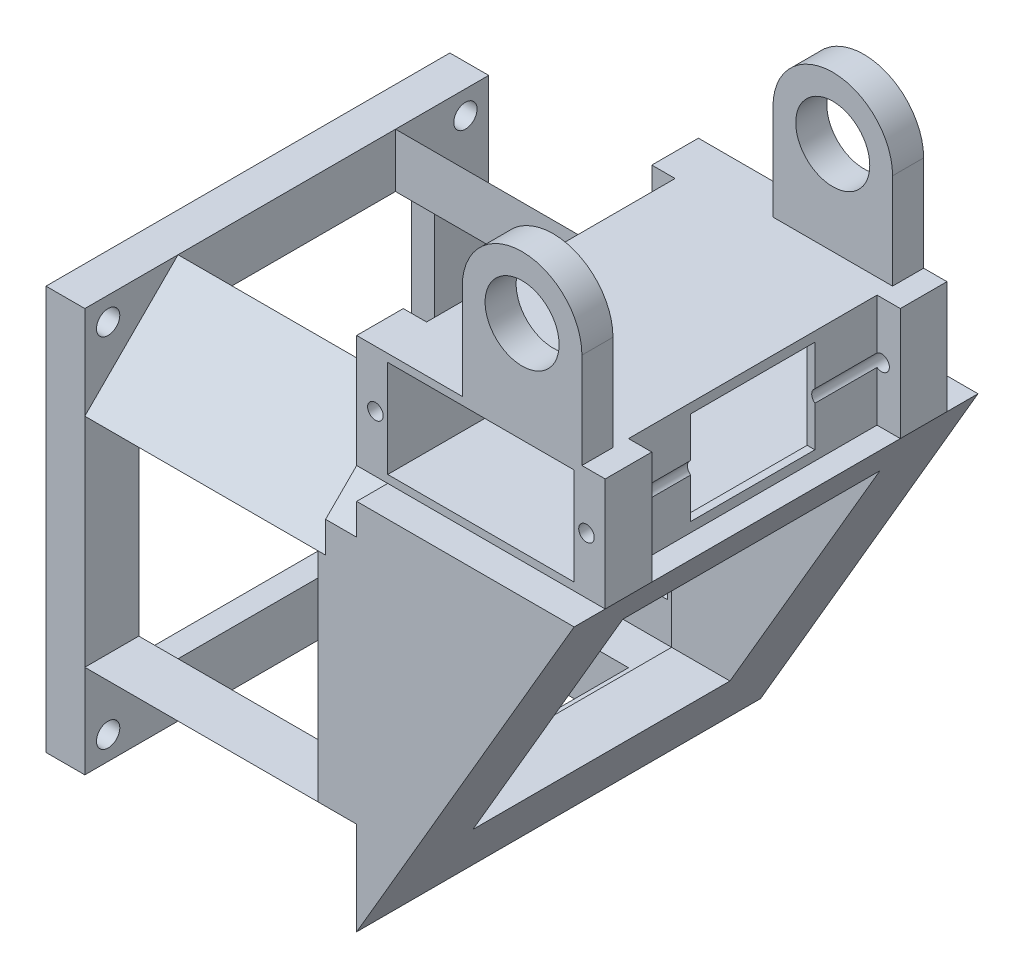
from build123d import *

# Parameters (mm, degrees)
SKETCH1_W            = 26
SKETCH1_H            = 14.5
SKETCH1_W_2          = 24
SKETCH1_H_2          = 12.5
BOSS_EXTRUDE1_DEPTH  = 22
SKETCH2_W            = 3
SKETCH2_H            = 14.5
BOSS_EXTRUDE2_DEPTH  = 6
CUT_EXTRUDE1_REACH   = 40.823
SKETCH3_W            = 16
SKETCH3_H            = 12
CUT_EXTRUDE2_REACH   = 55.873
SKETCH4_R            = 1
SKETCH5_W            = 44
SKETCH5_H            = 44
SKETCH5_W_2          = 38.1
SKETCH5_H_2          = 38.1
BOSS_EXTRUDE3_DEPTH  = 40
SKETCH8_W            = 52
SKETCH8_H            = 52
SKETCH8_W_2          = 44
SKETCH8_H_2          = 44
BOSS_EXTRUDE5_DEPTH  = 36
SKETCH6_R            = 25
CUT_EXTRUDE5_DEPTH   = 2
BOSS_EXTRUDE6_DEPTH  = 4
CHAMFER1_SIZE        = 12
CUT_EXTRUDE7_REACH   = 83.884
SKETCH11_W           = 30
SKETCH11_H           = 28
CUT_EXTRUDE8_REACH   = 72.569
SKETCH12_W           = 30
SKETCH12_H           = 28
CHAMFER3_SIZE        = 4
SKETCH14_R           = 1.5
BOSS_EXTRUDE7_DEPTH  = 5
SKETCH15_W           = 38.1
SKETCH15_H           = 38.1
SKETCH15_W_2         = 33.1
SKETCH15_H_2         = 33.1
BOSS_EXTRUDE8_DEPTH  = 2
SKETCH16_W           = 15.4
SKETCH16_H           = 4
BOSS_EXTRUDE9_DEPTH  = 20
CUT_EXTRUDE10_START  = -44
SKETCH18_R           = 4.765
CUT_EXTRUDE10_DEPTH  = 44
FILLET4_RADIUS       = 7.7
FILLET4_LENGTH       = 4
FILLET5_RADIUS       = 7.7
FILLET5_LENGTH       = 4
BOSS_EXTRUDE10_REACH = 83.884
CUT_EXTRUDE12_REACH  = 70.389
SKETCH15_3_W         = 33.1
SKETCH15_3_H         = 33.1


# Some blends are built 0.0001 mm under size
with BuildPart() as part:
    # Sketch1 → Boss-Extrude1 (new body)
    with BuildSketch(Plane.XY):
        with Locations((12, 6.25)):
            Rectangle(SKETCH1_W, SKETCH1_H)
        with Locations((12, 6.25)):
            Rectangle(SKETCH1_W_2, SKETCH1_H_2, mode=Mode.SUBTRACT)
    boss_extrude1 = extrude(amount=BOSS_EXTRUDE1_DEPTH)

    # Sketch2 → Boss-Extrude2 (add)
    with BuildSketch(Plane.XY.offset(22)):
        with Locations((-2.5, 6.25)):
            Rectangle(SKETCH2_W, SKETCH2_H)
        with Locations((26.5, 6.25)):
            Rectangle(SKETCH2_W, SKETCH2_H)
    boss_extrude2 = extrude(amount=-BOSS_EXTRUDE2_DEPTH)

    # Mirror2: Boss-Extrude1, Boss-Extrude2 across plane
    add(boss_extrude1.mirror(Plane(origin=(0, 0, 0), x_dir=(1, 0, 0), z_dir=(0, 0, -1))))
    add(boss_extrude2.mirror(Plane(origin=(0, 0, 0), x_dir=(1, 0, 0), z_dir=(0, 0, -1))))

    # Cut-Extrude1: up to this face of the body (flat: up to its plane)
    cut_extrude1_end = Plane(part.part.faces().sort_by_distance((25, 6.25, 0))[0])
    # Sketch3 → Cut-Extrude1 (cut, up to the picked face)
    with BuildSketch(Plane.ZY.offset(1), mode=Mode.PRIVATE) as cut_extrude1_sk1:
        with Locations((0, 6.25)):
            Rectangle(SKETCH3_W, SKETCH3_H)
    cut_extrude1_tool1 = split(extrude(cut_extrude1_sk1.sketch, amount=-CUT_EXTRUDE1_REACH, mode=Mode.PRIVATE), bisect_by=cut_extrude1_end, keep=Keep.BOTH, mode=Mode.PRIVATE)
    add(cut_extrude1_tool1.solids().sort_by(Axis((-1, 6.25, 0), (1, 0, 0)))[0], mode=Mode.SUBTRACT)

    # Sketch4 → Cut-Extrude2 (cut, up to next)
    with BuildSketch(Plane.XY.offset(22), mode=Mode.PRIVATE) as cut_extrude2_sk1:
        with Locations((-1.59, 6.25)):
            Circle(SKETCH4_R)
    cut_extrude2_tool1 = extrude(cut_extrude2_sk1.sketch, amount=-CUT_EXTRUDE2_REACH, mode=Mode.PRIVATE) & part.part
    # Sketch4 → Cut-Extrude2 (cut, up to next)
    with BuildSketch(Plane.XY.offset(22), mode=Mode.PRIVATE) as cut_extrude2_sk2:
        with Locations(Location((25.59, 6.25, 0), (0, 0, 233.842991799))):
            Circle(SKETCH4_R)
    cut_extrude2_tool2 = extrude(cut_extrude2_sk2.sketch, amount=-CUT_EXTRUDE2_REACH, mode=Mode.PRIVATE) & part.part
    add(cut_extrude2_tool1.solids().sort_by_distance((-1.59, 6.25, 22))[0], mode=Mode.SUBTRACT)
    add(cut_extrude2_tool1.solids().sort_by_distance((-1.59, 6.25, 22))[1], mode=Mode.SUBTRACT)
    add(cut_extrude2_tool2.solids().sort_by_distance((25.59, 6.25, 22))[0], mode=Mode.SUBTRACT)
    add(cut_extrude2_tool2.solids().sort_by_distance((25.59, 6.25, 22))[1], mode=Mode.SUBTRACT)

    # Sketch5 → Boss-Extrude3 (add)
    with BuildSketch(Plane(origin=(0, 0, 0), x_dir=(0, 0, -1), z_dir=(1, 0, 0))):
        with Locations((0, -23)):
            Rectangle(SKETCH5_W, SKETCH5_H)
        with Locations((0, -23)):
            Rectangle(SKETCH5_W_2, SKETCH5_H_2, mode=Mode.SUBTRACT)
    extrude(amount=-BOSS_EXTRUDE3_DEPTH)

    # Sketch8 → Boss-Extrude5 (add)
    with BuildSketch(Plane.ZY.offset(40)):
        with Locations((0, -23)):
            Rectangle(SKETCH8_W, SKETCH8_H)
        with Locations((0, -23)):
            Rectangle(SKETCH8_W_2, SKETCH8_H_2, mode=Mode.SUBTRACT)
    extrude(amount=-BOSS_EXTRUDE5_DEPTH)

    # Sketch6 → Cut-Extrude5 (cut)
    with BuildSketch(Plane.ZY.offset(40)):
        with Locations((0, -23)):
            Circle(SKETCH6_R)
    extrude(amount=-CUT_EXTRUDE5_DEPTH, mode=Mode.SUBTRACT)

    # Sketch9 → Boss-Extrude6 (add)
    with BuildSketch(Plane(origin=(-4, 0, 0), x_dir=(0, 0, -1), z_dir=(1, 0, 0))):
        Polygon((-26, -49), (26, -49), (26, -1), (22, -1), (22, -45), (-22, -45), (-22, -1), (-26, -1), align=None)
    extrude(amount=BOSS_EXTRUDE6_DEPTH)

    # Chamfer1
    # the kernel refuses this chamfer: 12 mm, written as the material it takes off along each edge
    with BuildSketch(Plane(origin=(-70.860195856, 3, 26), x_dir=(0, 0.027495876610586382, -0.9996219169112968), z_dir=(1, 0, 0))) as chamfer1_piece_1:
        Polygon((CHAMFER1_SIZE * 0.999621916911, -CHAMFER1_SIZE * 0.0274958766106), (-CHAMFER1_SIZE * 0.0274958766106, -CHAMFER1_SIZE * 0.999621916911), (0, 0), align=None)
    extrude(amount=66.860195856, mode=Mode.SUBTRACT)
    with BuildSketch(Plane(origin=(30.860195856, -49, 26), x_dir=(0, -0.027495876610586202, -0.9996219169112968), z_dir=(-1, 0, 0)), Plane(origin=(-70.860195856, -49, -26), x_dir=(0, -0.027495876610586202, 0.9996219169112968), z_dir=(1, 0, 0))) as chamfer1_piece_2:
        Polygon((CHAMFER1_SIZE * 0.999621916911, -CHAMFER1_SIZE * 0.0274958766106), (-CHAMFER1_SIZE * 0.0274958766106, -CHAMFER1_SIZE * 0.999621916911), (0, 0), align=None)
    extrude(amount=101.720391711, mode=Mode.SUBTRACT)
    with BuildSketch(Plane(origin=(-70.860195856, 3, -26), x_dir=(0, 0.027495876610586382, 0.9996219169112968), z_dir=(1, 0, 0))) as chamfer1_piece_3:
        Polygon((CHAMFER1_SIZE * 0.999621916911, CHAMFER1_SIZE * 0.0274958766106), (-CHAMFER1_SIZE * 0.0274958766106, CHAMFER1_SIZE * 0.999621916911), (0, 0), align=None)
    extrude(amount=66.860195856, mode=Mode.SUBTRACT)

    # Cut-Extrude7: up to this face of the body (flat: up to its plane)
    cut_extrude7_end = Plane(part.part.faces().sort_by_distance((-19.5, -22.5, -26))[0])
    # Sketch11 → Cut-Extrude7 (cut, up to the picked face)
    with BuildSketch(Plane.XY.offset(26), mode=Mode.PRIVATE) as cut_extrude7_sk1:
        with Locations((-20, -23)):
            Rectangle(SKETCH11_W, SKETCH11_H)
    cut_extrude7_tool1 = split(extrude(cut_extrude7_sk1.sketch, amount=-CUT_EXTRUDE7_REACH, mode=Mode.PRIVATE), bisect_by=cut_extrude7_end, keep=Keep.BOTH, mode=Mode.PRIVATE)
    add(cut_extrude7_tool1.solids().sort_by(Axis((-20, -23, 26), (0, 0, -1)))[0], mode=Mode.SUBTRACT)

    # Cut-Extrude8: up to this face of the body (flat: up to its plane)
    cut_extrude8_end = Plane(part.part.faces().sort_by_distance((-20, -49, 0))[0])
    # Sketch12 → Cut-Extrude8 (cut, up to the picked face)
    with BuildSketch(Plane(origin=(0, 3, 0), x_dir=(1, 0, 0), z_dir=(0, 1, 0)), mode=Mode.PRIVATE) as cut_extrude8_sk1:
        with Locations((-20, 0)):
            Rectangle(SKETCH12_W, SKETCH12_H)
    cut_extrude8_tool1 = split(extrude(cut_extrude8_sk1.sketch, amount=-CUT_EXTRUDE8_REACH, mode=Mode.PRIVATE), bisect_by=cut_extrude8_end, keep=Keep.BOTH, mode=Mode.PRIVATE)
    add(cut_extrude8_tool1.solids().sort_by(Axis((-20, 3, 0), (0, -1, 0)))[0], mode=Mode.SUBTRACT)

    # Chamfer3
    chamfer3_edges = [part.edges().sort_by_distance(p)[0] for p in [
        (-2, -1, -26),
        (-2, -1, 26),
    ]]
    chamfer(chamfer3_edges, length=CHAMFER3_SIZE - 0.0001)  # a hair under: the kernel refuses the full size

    # Sketch14 → Boss-Extrude7 (add)
    # profile 1 of 4: a face of its own
    with BuildSketch(Plane.ZY.offset(40)):
        Polygon((-26, 3), (-14, 3), (-26, -9), align=None)
        with Locations((-23, 0)):
            Circle(SKETCH14_R, mode=Mode.SUBTRACT)
    # profile 2 of 4: a face of its own
    with BuildSketch(Plane.ZY.offset(40)):
        Polygon((14, 3), (26, -9), (26, 3), align=None)
        with Locations((23, 0)):
            Circle(SKETCH14_R, mode=Mode.SUBTRACT)
    # profile 3 of 4: a face of its own
    with BuildSketch(Plane.ZY.offset(40)):
        Polygon((26, -49), (14, -49), (26, -37), align=None)
        with Locations((23, -46)):
            Circle(SKETCH14_R, mode=Mode.SUBTRACT)
    # profile 4 of 4: a face of its own
    with BuildSketch(Plane.ZY.offset(40)):
        Polygon((-26, -49), (-26, -37), (-14, -49), align=None)
        with Locations((-23, -46)):
            Circle(SKETCH14_R, mode=Mode.SUBTRACT)
    extrude(amount=-BOSS_EXTRUDE7_DEPTH)

    # Sketch15 → Boss-Extrude8 (add)
    with BuildSketch(Plane(origin=(0, 0, 0), x_dir=(0, 0, -1), z_dir=(1, 0, 0))):
        with Locations((0, -23)):
            Rectangle(SKETCH15_W, SKETCH15_H)
        with Locations((0, -23)):
            Rectangle(SKETCH15_W_2, SKETCH15_H_2, mode=Mode.SUBTRACT)
    extrude(amount=-BOSS_EXTRUDE8_DEPTH)

    # Sketch16 → Boss-Extrude9 (add)
    with BuildSketch(Plane(origin=(0, 13.5, 0), x_dir=(1, 0, 0), z_dir=(0, 1, 0))):
        with Locations((17.3, -20)):
            Rectangle(SKETCH16_W, SKETCH16_H)
        with Locations((17.3, 20)):
            Rectangle(SKETCH16_W, SKETCH16_H)
    extrude(amount=BOSS_EXTRUDE9_DEPTH)

    # Sketch18 → Cut-Extrude10 (cut)
    with BuildSketch(Plane.XY.offset(22).offset(CUT_EXTRUDE10_START)):
        with Locations((17.3, 25.5)):
            Circle(SKETCH18_R)
    extrude(amount=CUT_EXTRUDE10_DEPTH, mode=Mode.SUBTRACT)

    # Fillet4: full round fillet: the end face becomes a half cylinder, R = half its width
    fillet4_face = Plane((17.3, 33.5, 20), x_dir=(0, 0, -1), z_dir=(0, 1, 0))  # on the end face: x along it, z out of the body
    fillet4_slab = fillet4_face.offset(-FILLET4_RADIUS / 2) * Box(FILLET4_LENGTH, 2 * FILLET4_RADIUS, FILLET4_RADIUS, mode=Mode.PRIVATE)  # the body's end, R deep
    fillet4_round = Plane((17.3, 25.8, 20), x_dir=(0, 1, 0), z_dir=(0, 0, -1)) * Cylinder(FILLET4_RADIUS, FILLET4_LENGTH, mode=Mode.PRIVATE)  # its axis R under the face
    add(fillet4_slab - fillet4_round, mode=Mode.SUBTRACT)

    # Fillet5: full round fillet: the end face becomes a half cylinder, R = half its width
    fillet5_face = Plane((17.3, 33.5, -20), x_dir=(0, 0, -1), z_dir=(0, 1, 0))  # on the end face: x along it, z out of the body
    fillet5_slab = fillet5_face.offset(-FILLET5_RADIUS / 2) * Box(FILLET5_LENGTH, 2 * FILLET5_RADIUS, FILLET5_RADIUS, mode=Mode.PRIVATE)  # the body's end, R deep
    fillet5_round = Plane((17.3, 25.8, -20), x_dir=(0, 1, 0), z_dir=(0, 0, -1)) * Cylinder(FILLET5_RADIUS, FILLET5_LENGTH, mode=Mode.PRIVATE)  # its axis R under the face
    add(fillet5_slab - fillet5_round, mode=Mode.SUBTRACT)

    # Boss-Extrude10: up to this face of the body (flat: up to its plane)
    boss_extrude10_end = Plane(part.part.faces().sort_by_distance((-2.448716798, -21.358932413, -26))[0])
    # Sketch19 → Boss-Extrude10 (add, up to the picked face)
    with BuildSketch(Plane.XY.offset(26), mode=Mode.PRIVATE) as boss_extrude10_sk1:
        Polygon((0, -49), (28, -1), (0, -1), align=None)
    boss_extrude10_tool1 = split(extrude(boss_extrude10_sk1.sketch, amount=-BOSS_EXTRUDE10_REACH, mode=Mode.PRIVATE), bisect_by=boss_extrude10_end, keep=Keep.BOTH, mode=Mode.PRIVATE)
    add(boss_extrude10_tool1.solids().sort_by(Axis((9.333333, -17, 26), (0, 0, -1)))[0])

    # Cut-Extrude12: up to this face of the body (flat: up to its plane)
    cut_extrude12_end = Plane(part.part.faces().sort_by_distance((14, -25, 0))[0])
    # Sketch15<3> → Cut-Extrude12 (cut, up to the picked face)
    with BuildSketch(Plane(origin=(0, 0, 0), x_dir=(0, 0, -1), z_dir=(1, 0, 0)), mode=Mode.PRIVATE) as cut_extrude12_sk1:
        with Locations((0, -23)):
            Rectangle(SKETCH15_3_W, SKETCH15_3_H)
    cut_extrude12_tool1 = split(extrude(cut_extrude12_sk1.sketch, amount=CUT_EXTRUDE12_REACH, mode=Mode.PRIVATE), bisect_by=cut_extrude12_end, keep=Keep.BOTH, mode=Mode.PRIVATE)
    add(cut_extrude12_tool1.solids().sort_by(Axis((0, -23, 0), (1, 0, 0)))[0], mode=Mode.SUBTRACT)


solid = part.part
